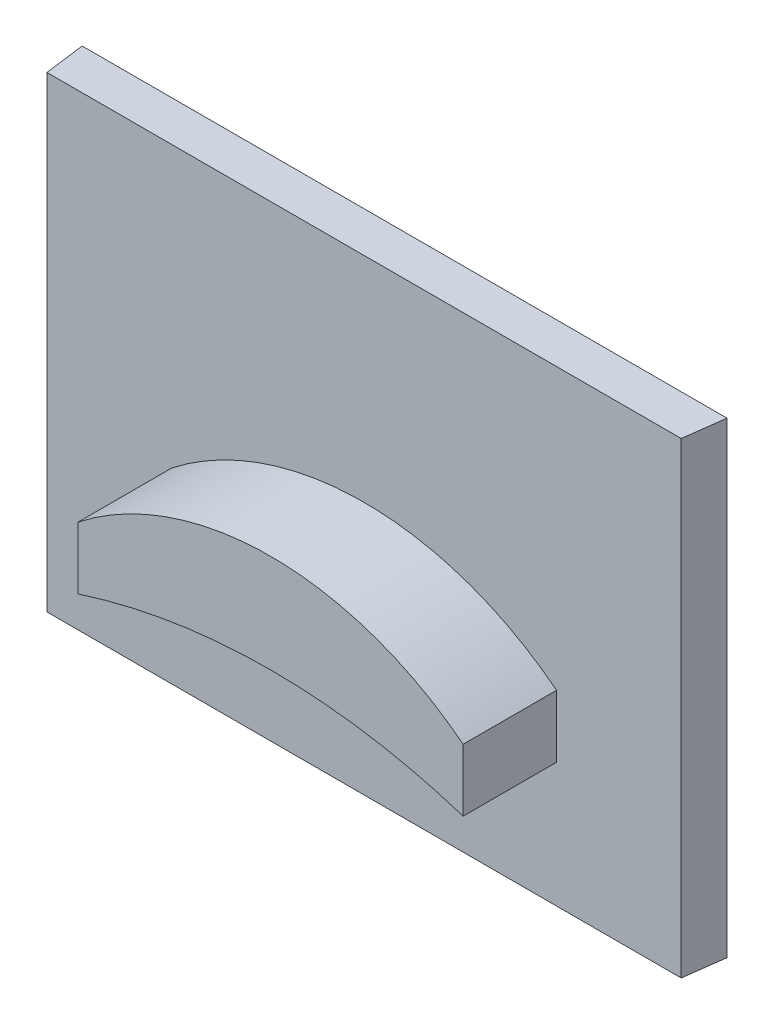
from build123d import *

# Parameters (mm, degrees)
RESSALTO_EXTRUS_O1_DEPTH = 15
RESSALTO_EXTRUS_O2_DEPTH = 3


with BuildPart() as part:
    # Esboço1 → Ressalto-extrusão1 (new body)
    with BuildSketch(Plane(origin=(0, 0, 0), x_dir=(1, 0, 0), z_dir=(0, 1, 0))):
        Polygon((10.162691683, 85.099878857), (10.333844345, 86.399912395), (-10.365601698, 86.395859306), (-10.19445786, 85.095892792), align=None)
    extrude(amount=RESSALTO_EXTRUS_O1_DEPTH)

    # Esboço2 → Ressalto-extrusão2 (add)
    with BuildSketch(Plane(origin=(-0.016662731, 0, -85.097885672), x_dir=(0.99999998082988, 0, -0.00019580663883939192), z_dir=(0.00019580663883939195, 0, 0.9999999808298801))):
        with BuildLine():
            Line((-6.177795324, 6), (-6.177795324, 4))
            ThreePointArc((-6.177795324, 4), (0.000779643, 4.978296307), (6.179354609, 4))
            Line((6.179354609, 4), (6.179354609, 6))
            ThreePointArc((6.179354609, 6), (0.000779643, 8.137099048), (-6.177795324, 6))
        make_face()
    extrude(amount=RESSALTO_EXTRUS_O2_DEPTH)


solid = part.part
